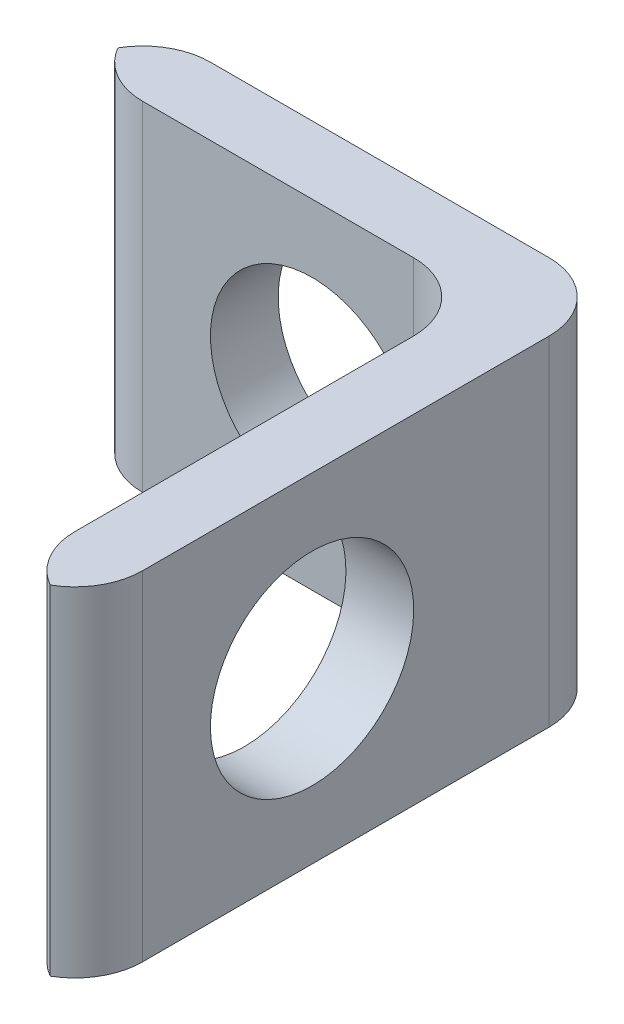
from build123d import *

# Parameters (mm, degrees)
SKETCH1_W           = 7
SKETCH1_H           = 5
SKETCH1_R           = 1.5
BOSS_EXTRUDE1_DEPTH = 1
SKETCH2_W           = 1
SKETCH2_H           = 5
BOSS_EXTRUDE2_DEPTH = 7
SKETCH3_R           = 1.5
CUT_EXTRUDE1_DEPTH  = 1
FILLET1_R           = 1
FILLET4_R           = 1
FILLET5_R           = 1


# Some blends are built 0.0001 mm under size
with BuildPart() as part:
    # Sketch1 → Boss-Extrude1 (new body)
    with BuildSketch(Plane.XY):
        with Locations((3.5, 2.5)):
            Rectangle(SKETCH1_W, SKETCH1_H)
        with Locations((3.5, 2.5)):
            Circle(SKETCH1_R, mode=Mode.SUBTRACT)
    extrude(amount=BOSS_EXTRUDE1_DEPTH)

    # Sketch2 → Boss-Extrude2 (add)
    with BuildSketch(Plane.XY.offset(1)):
        with Locations((6.5, 2.5)):
            Rectangle(SKETCH2_W, SKETCH2_H)
    extrude(amount=BOSS_EXTRUDE2_DEPTH)

    # Sketch3 → Cut-Extrude1 (cut)
    with BuildSketch(Plane.ZY.offset(-6)):
        with Locations(Location((4.5, 2.5, 0), (0, 0, 270))):
            Circle(SKETCH3_R)
    extrude(amount=-CUT_EXTRUDE1_DEPTH, mode=Mode.SUBTRACT)

    # Fillet1
    fillet1_edges = [part.edges().sort_by_distance(p)[0] for p in [
        (6, 2.5, 1),
    ]]
    fillet(fillet1_edges, radius=FILLET1_R - 0.0001)  # a hair under: the kernel refuses the full size

    # Fillet4
    # the kernel refuses this fillet: 1 mm, written as the material it takes off along each edge
    with BuildSketch(Plane(origin=(7, -2.5, 8), x_dir=(-1, 0, 0), z_dir=(0, 1, 0)), Plane(origin=(0, 7.5, 1), x_dir=(1, 0, 0), z_dir=(0, -1, 0)), Plane(origin=(0, 7.5, 0), x_dir=(0, 0, 1), z_dir=(0, -1, 0))) as fillet4_piece_1:
        with BuildLine():
            CenterArc((FILLET4_R, -FILLET4_R), FILLET4_R, 90, 90)
            Line((0, -FILLET4_R), (0, 0))
            Line((0, 0), (FILLET4_R, 0))
        make_face()
    extrude(amount=10, mode=Mode.SUBTRACT)
    with BuildSketch(Plane(origin=(6, 7.5, 8), x_dir=(0, 0, -1), z_dir=(0, -1, 0))) as fillet4_piece_2:
        with BuildLine():
            CenterArc((FILLET4_R, FILLET4_R), FILLET4_R, 180, 90)
            Line((0, FILLET4_R), (0, 0))
            Line((0, 0), (FILLET4_R, 0))
        make_face()
    extrude(amount=10, mode=Mode.SUBTRACT)

    # Fillet5
    fillet5_edges = [part.edges().sort_by_distance(p)[0] for p in [
        (7, 2.5, 0),
    ]]
    fillet(fillet5_edges, radius=FILLET5_R)


solid = part.part
